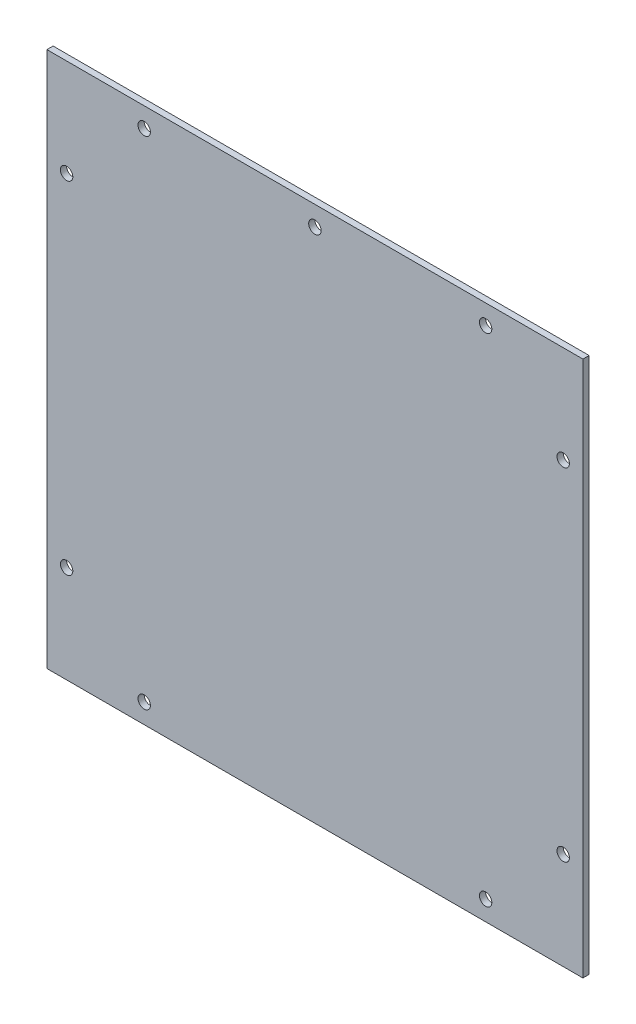
from build123d import *

# Parameters (mm, degrees)
SKETCH2_W           = 345.4
SKETCH2_H           = 345.4
SKETCH2_R           = 4
BOSS_EXTRUDE2_DEPTH = 4


with BuildPart() as part:
    # Sketch2 → Boss-Extrude2 (new body)
    with BuildSketch(Plane.XY):
        Rectangle(SKETCH2_W, SKETCH2_H)
        with Locations((-110, 160)):
            Circle(SKETCH2_R, mode=Mode.SUBTRACT)
        with Locations((-160, 110)):
            Circle(SKETCH2_R, mode=Mode.SUBTRACT)
        with Locations((-160, -110)):
            Circle(SKETCH2_R, mode=Mode.SUBTRACT)
        with Locations((-110, -160)):
            Circle(SKETCH2_R, mode=Mode.SUBTRACT)
        with Locations((110, -160)):
            Circle(SKETCH2_R, mode=Mode.SUBTRACT)
        with Locations((160, -110)):
            Circle(SKETCH2_R, mode=Mode.SUBTRACT)
        with Locations((160, 110)):
            Circle(SKETCH2_R, mode=Mode.SUBTRACT)
        with Locations((110, 160)):
            Circle(SKETCH2_R, mode=Mode.SUBTRACT)
        with Locations((0, 160)):
            Circle(SKETCH2_R, mode=Mode.SUBTRACT)
    extrude(amount=BOSS_EXTRUDE2_DEPTH)


solid = part.part
